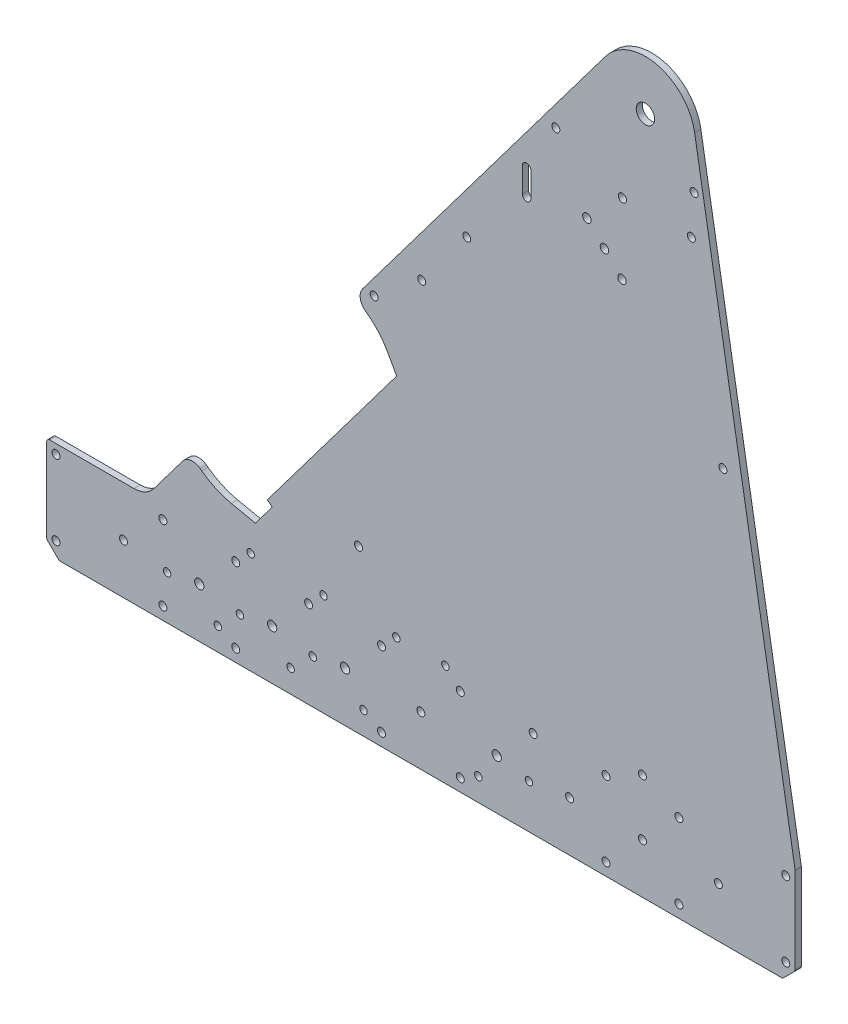
from build123d import *

# Parameters (mm, degrees)
BOSS_EXTRUDE1_DEPTH = 3.175
CUT_EXTRUDE1_REACH  = 534.132
SKETCH2_R           = 2.032
SKETCH5_R           = 2.032
SKETCH5_R_2         = 2.38125
CUT_EXTRUDE4_DEPTH  = 533.132273265
SKETCH6_R           = 2.032
CUT_EXTRUDE5_DEPTH  = 533.132273265
SKETCH3_R           = 4.699
SKETCH3_R_2         = 2.032
SKETCH3_R_3         = 2.0955
SKETCH3_R_4         = 2.159
CUT_EXTRUDE2_DEPTH  = 533.132273265
FILLET1_R           = 1.5875
CUT_EXTRUDE3_REACH  = 534.132
SKETCH4_R           = 1.905
FILLET2_R           = 38.1
FILLET3_R           = 6.35


with BuildPart() as part:
    # Sketch1 → Boss-Extrude1 (new body)
    with BuildSketch(Plane.XY):
        with BuildLine():
            Line((0, 0), (381, 0))
            Line((381, 0), (381, 50.8))
            Line((381, 50.8), (329.837432577, 350.351326687))
            ThreePointArc((329.837432577, 350.351326687), (310.787920632, 370.759100277), (284.504927721, 361.348180455))
            Line((284.504927721, 361.348180455), (157.027492501, 191.955579526))
            Line((157.027492501, 191.955579526), (169.711912675, 182.409841741))
            Line((169.711912675, 182.409841741), (178.167615548, 167.244965001))
            Line((178.167615548, 167.244965001), (112.326505112, 79.754995301))
            Line((112.326505112, 79.754995301), (114.863389147, 77.845847744))
            Line((114.863389147, 77.845847744), (106.272225141, 66.429869588))
            Line((106.272225141, 66.429869588), (85.709420174, 70.786944209))
            Line((85.709420174, 70.786944209), (73.025, 80.332681993))
            Line((73.025, 80.332681993), (54.610499914, 55.863409773))
            ThreePointArc((54.610499914, 55.863409773), (50.133294634, 52.136138511), (44.462963775, 50.8))
            Line((44.462963775, 50.8), (0, 50.8))
            Line((0, 50.8), (0, 0))
        make_face()
    extrude(amount=BOSS_EXTRUDE1_DEPTH)

    # Sketch2 → Cut-Extrude1 (cut, up to next)
    with BuildSketch(Plane.XY.offset(3.175), mode=Mode.PRIVATE) as cut_extrude1_sk1:
        with Locations((4.7625, 46.0375)):
            Circle(SKETCH2_R)
    cut_extrude1_tool1 = extrude(cut_extrude1_sk1.sketch, amount=-CUT_EXTRUDE1_REACH, mode=Mode.PRIVATE) & part.part
    # Sketch2 → Cut-Extrude1 (cut, up to next)
    with BuildSketch(Plane.XY.offset(3.175), mode=Mode.PRIVATE) as cut_extrude1_sk2:
        with Locations((4.7625, 7.9375)):
            Circle(SKETCH2_R)
    cut_extrude1_tool2 = extrude(cut_extrude1_sk2.sketch, amount=-CUT_EXTRUDE1_REACH, mode=Mode.PRIVATE) & part.part
    # Sketch2 → Cut-Extrude1 (cut, up to next)
    with BuildSketch(Plane.XY.offset(3.175), mode=Mode.PRIVATE) as cut_extrude1_sk3:
        with Locations((376.2375, 7.9375)):
            Circle(SKETCH2_R)
    cut_extrude1_tool3 = extrude(cut_extrude1_sk3.sketch, amount=-CUT_EXTRUDE1_REACH, mode=Mode.PRIVATE) & part.part
    # Sketch2 → Cut-Extrude1 (cut, up to next)
    with BuildSketch(Plane.XY.offset(3.175), mode=Mode.PRIVATE) as cut_extrude1_sk4:
        with Locations((376.2375, 46.0375)):
            Circle(SKETCH2_R)
    cut_extrude1_tool4 = extrude(cut_extrude1_sk4.sketch, amount=-CUT_EXTRUDE1_REACH, mode=Mode.PRIVATE) & part.part
    # Sketch2 → Cut-Extrude1 (cut, up to next)
    with BuildSketch(Plane.XY.offset(3.175), mode=Mode.PRIVATE) as cut_extrude1_sk5:
        Polygon((0, 6.35), (0, 0), (6.35, 0), align=None)
    cut_extrude1_tool5 = extrude(cut_extrude1_sk5.sketch, amount=-CUT_EXTRUDE1_REACH, mode=Mode.PRIVATE) & part.part
    # Sketch2 → Cut-Extrude1 (cut, up to next)
    with BuildSketch(Plane.XY.offset(3.175), mode=Mode.PRIVATE) as cut_extrude1_sk6:
        Polygon((381, 0), (374.65, 0), (381, 6.35), align=None)
    cut_extrude1_tool6 = extrude(cut_extrude1_sk6.sketch, amount=-CUT_EXTRUDE1_REACH, mode=Mode.PRIVATE) & part.part
    add(cut_extrude1_tool1.solids().sort_by_distance((4.7625, 46.0375, 3.175))[0], mode=Mode.SUBTRACT)
    add(cut_extrude1_tool2.solids().sort_by_distance((4.7625, 7.9375, 3.175))[0], mode=Mode.SUBTRACT)
    add(cut_extrude1_tool3.solids().sort_by_distance((376.2375, 7.9375, 3.175))[0], mode=Mode.SUBTRACT)
    add(cut_extrude1_tool4.solids().sort_by_distance((376.2375, 46.0375, 3.175))[0], mode=Mode.SUBTRACT)
    add(cut_extrude1_tool5.solids().sort_by_distance((2.116667, 2.116667, 3.175))[0], mode=Mode.SUBTRACT)
    add(cut_extrude1_tool6.solids().sort_by_distance((378.883333, 2.116667, 3.175))[0], mode=Mode.SUBTRACT)

    # Sketch5 → Cut-Extrude4 (cut, through all)
    with BuildSketch(Plane.XY.offset(3.175)):
        with Locations((39.116, 25.4)):
            Circle(SKETCH5_R)
        with Locations((59.182, 6.35)):
            Circle(SKETCH5_R)
        with Locations((59.182, 44.45)):
            Circle(SKETCH5_R)
        with Locations((96.266, 44.45)):
            Circle(SKETCH5_R)
        with Locations((133.35, 44.45)):
            Circle(SKETCH5_R)
        with Locations((170.434, 44.45)):
            Circle(SKETCH5_R)
        with Locations((210.566, 44.45)):
            Circle(SKETCH5_R)
        with Locations((210.566, 6.35)):
            Circle(SKETCH5_R)
        with Locations((170.434, 6.35)):
            Circle(SKETCH5_R)
        with Locations((247.65, 44.45)):
            Circle(SKETCH5_R)
        with Locations((266.192, 25.4)):
            Circle(SKETCH5_R)
        with Locations((77.724, 25.4)):
            Circle(SKETCH5_R_2)
        with Locations((114.808, 25.4)):
            Circle(SKETCH5_R_2)
        with Locations((151.892, 25.4)):
            Circle(SKETCH5_R_2)
        with Locations((229.108, 25.4)):
            Circle(SKETCH5_R_2)
        with Locations((190.5, 25.4)):
            Circle(SKETCH5_R)
        with Locations((303.276, 25.4)):
            Circle(SKETCH5_R)
        with Locations((341.884, 25.4)):
            Circle(SKETCH5_R)
    extrude(amount=-CUT_EXTRUDE4_DEPTH, mode=Mode.SUBTRACT)

    # Sketch6 → Cut-Extrude5 (cut, through all)
    with BuildSketch(Plane.XY.offset(3.175)):
        with Locations((284.734, 44.45)):
            Circle(SKETCH6_R)
        with Locations((284.734, 6.35)):
            Circle(SKETCH6_R)
        with Locations((321.818, 6.35)):
            Circle(SKETCH6_R)
        with Locations((321.818, 44.45)):
            Circle(SKETCH6_R)
        with Locations((96.266, 6.35)):
            Circle(SKETCH6_R)
        with Locations((303.276, 53.975)):
            Circle(SKETCH6_R)
    extrude(amount=-CUT_EXTRUDE5_DEPTH, mode=Mode.SUBTRACT)

    # Sketch3 → Cut-Extrude2 (cut, through all)
    with BuildSketch(Plane.XY.offset(3.175)):
        with Locations((304.8, 346.075)):
            Circle(SKETCH3_R)
        with Locations((166.6875, 196.85)):
            Circle(SKETCH3_R_2)
        with Locations((158.75, 82.55)):
            Circle(SKETCH3_R_2)
        with Locations((293.065185898, 303.201970739)):
            Circle(SKETCH3_R_3)
        with Locations((275.00852204, 285.338127639)):
            Circle(SKETCH3_R_4)
        with Locations((283.94044359, 276.30979571)):
            Circle(SKETCH3_R_4)
        with Locations((292.872365141, 267.281463781)):
            Circle(SKETCH3_R_4)
        with Locations((328.186766793, 303.440372165)):
            Circle(SKETCH3_R_2)
        with Locations((344.222991868, 209.55)):
            Circle(SKETCH3_R_2)
        with Locations((259.211844923, 317.178274551)):
            Circle(SKETCH3_R_2)
        with Locations((213.851281588, 246.342608418)):
            Circle(SKETCH3_R_2)
        with Locations((190.941510906, 215.9)):
            Circle(SKETCH3_R_2)
        with Locations((329.532322641, 323.85)):
            Circle(SKETCH3_R_2)
        with BuildLine():
            Line((242.153661094, 279.4), (242.153661094, 292.1))
            ThreePointArc((242.153661094, 292.1), (244.312661094, 294.259), (246.471661094, 292.1))
            Line((246.471661094, 292.1), (246.471661094, 279.4))
            ThreePointArc((246.471661094, 279.4), (244.312661094, 277.241), (242.153661094, 279.4))
        make_face()
    extrude(amount=-CUT_EXTRUDE2_DEPTH, mode=Mode.SUBTRACT)

    # Fillet1
    fillet1_edges = [part.edges().sort_by_distance(p)[0] for p in [
        (374.65, 0, 1.5875),
        (381, 6.35, 1.5875),
        (381, 50.8, 1.5875),
        (6.35, 0, 1.5875),
        (0, 6.35, 1.5875),
        (0, 50.8, 1.5875),
    ]]
    fillet(fillet1_edges, radius=FILLET1_R)

    # Sketch4 → Cut-Extrude3 (cut, up to next)
    with BuildSketch(Plane(origin=(0, 0, 0), x_dir=(-1, 0, 0), z_dir=(0, 0, -1)), mode=Mode.PRIVATE) as cut_extrude3_sk1:
        with Locations((-61.318145625, 22.298133105)):
            Circle(SKETCH4_R)
    cut_extrude3_tool1 = extrude(cut_extrude3_sk1.sketch, amount=-CUT_EXTRUDE3_REACH, mode=Mode.PRIVATE) & part.part
    # Sketch4 → Cut-Extrude3 (cut, up to next)
    with BuildSketch(Plane(origin=(0, 0, 0), x_dir=(-1, 0, 0), z_dir=(0, 0, -1)), mode=Mode.PRIVATE) as cut_extrude3_sk2:
        with Locations((-87.131339764, 11.605958005)):
            Circle(SKETCH4_R)
    cut_extrude3_tool2 = extrude(cut_extrude3_sk2.sketch, amount=-CUT_EXTRUDE3_REACH, mode=Mode.PRIVATE) & part.part
    # Sketch4 → Cut-Extrude3 (cut, up to next)
    with BuildSketch(Plane(origin=(0, 0, 0), x_dir=(-1, 0, 0), z_dir=(0, 0, -1)), mode=Mode.PRIVATE) as cut_extrude3_sk3:
        with Locations((-98.402145625, 22.298133105)):
            Circle(SKETCH4_R)
    cut_extrude3_tool3 = extrude(cut_extrude3_sk3.sketch, amount=-CUT_EXTRUDE3_REACH, mode=Mode.PRIVATE) & part.part
    # Sketch4 → Cut-Extrude3 (cut, up to next)
    with BuildSketch(Plane(origin=(0, 0, 0), x_dir=(-1, 0, 0), z_dir=(0, 0, -1)), mode=Mode.PRIVATE) as cut_extrude3_sk4:
        with Locations((-124.215339764, 11.605958005)):
            Circle(SKETCH4_R)
    cut_extrude3_tool4 = extrude(cut_extrude3_sk4.sketch, amount=-CUT_EXTRUDE3_REACH, mode=Mode.PRIVATE) & part.part
    # Sketch4 → Cut-Extrude3 (cut, up to next)
    with BuildSketch(Plane(origin=(0, 0, 0), x_dir=(-1, 0, 0), z_dir=(0, 0, -1)), mode=Mode.PRIVATE) as cut_extrude3_sk5:
        with Locations((-135.486145625, 22.298133105)):
            Circle(SKETCH4_R)
    cut_extrude3_tool5 = extrude(cut_extrude3_sk5.sketch, amount=-CUT_EXTRUDE3_REACH, mode=Mode.PRIVATE) & part.part
    # Sketch4 → Cut-Extrude3 (cut, up to next)
    with BuildSketch(Plane(origin=(0, 0, 0), x_dir=(-1, 0, 0), z_dir=(0, 0, -1)), mode=Mode.PRIVATE) as cut_extrude3_sk6:
        with Locations((-161.299339764, 11.605958005)):
            Circle(SKETCH4_R)
    cut_extrude3_tool6 = extrude(cut_extrude3_sk6.sketch, amount=-CUT_EXTRUDE3_REACH, mode=Mode.PRIVATE) & part.part
    # Sketch4 → Cut-Extrude3 (cut, up to next)
    with BuildSketch(Plane(origin=(0, 0, 0), x_dir=(-1, 0, 0), z_dir=(0, 0, -1)), mode=Mode.PRIVATE) as cut_extrude3_sk7:
        with Locations((-245.513854375, 22.298133105)):
            Circle(SKETCH4_R)
    cut_extrude3_tool7 = extrude(cut_extrude3_sk7.sketch, amount=-CUT_EXTRUDE3_REACH, mode=Mode.PRIVATE) & part.part
    # Sketch4 → Cut-Extrude3 (cut, up to next)
    with BuildSketch(Plane(origin=(0, 0, 0), x_dir=(-1, 0, 0), z_dir=(0, 0, -1)), mode=Mode.PRIVATE) as cut_extrude3_sk8:
        with Locations((-219.700660236, 11.605958005)):
            Circle(SKETCH4_R)
    cut_extrude3_tool8 = extrude(cut_extrude3_sk8.sketch, amount=-CUT_EXTRUDE3_REACH, mode=Mode.PRIVATE) & part.part
    # Sketch4 → Cut-Extrude3 (cut, up to next)
    with BuildSketch(Plane(origin=(0, 0, 0), x_dir=(-1, 0, 0), z_dir=(0, 0, -1)), mode=Mode.PRIVATE) as cut_extrude3_sk9:
        with Locations((-202.981986443, 51.968407021)):
            Circle(SKETCH4_R)
    cut_extrude3_tool9 = extrude(cut_extrude3_sk9.sketch, amount=-CUT_EXTRUDE3_REACH, mode=Mode.PRIVATE) & part.part
    # Sketch4 → Cut-Extrude3 (cut, up to next)
    with BuildSketch(Plane(origin=(0, 0, 0), x_dir=(-1, 0, 0), z_dir=(0, 0, -1)), mode=Mode.PRIVATE) as cut_extrude3_sk10:
        with Locations((-178.018013557, 51.968407021)):
            Circle(SKETCH4_R)
    cut_extrude3_tool10 = extrude(cut_extrude3_sk10.sketch, amount=-CUT_EXTRUDE3_REACH, mode=Mode.PRIVATE) & part.part
    # Sketch4 → Cut-Extrude3 (cut, up to next)
    with BuildSketch(Plane(origin=(0, 0, 0), x_dir=(-1, 0, 0), z_dir=(0, 0, -1)), mode=Mode.PRIVATE) as cut_extrude3_sk11:
        with Locations((-140.934013557, 51.968407021)):
            Circle(SKETCH4_R)
    cut_extrude3_tool11 = extrude(cut_extrude3_sk11.sketch, amount=-CUT_EXTRUDE3_REACH, mode=Mode.PRIVATE) & part.part
    # Sketch4 → Cut-Extrude3 (cut, up to next)
    with BuildSketch(Plane(origin=(0, 0, 0), x_dir=(-1, 0, 0), z_dir=(0, 0, -1)), mode=Mode.PRIVATE) as cut_extrude3_sk12:
        with Locations((-103.850013557, 51.968407021)):
            Circle(SKETCH4_R)
    cut_extrude3_tool12 = extrude(cut_extrude3_sk12.sketch, amount=-CUT_EXTRUDE3_REACH, mode=Mode.PRIVATE) & part.part
    add(cut_extrude3_tool1.solids().sort_by_distance((61.318146, 22.298133, 0))[0], mode=Mode.SUBTRACT)
    add(cut_extrude3_tool2.solids().sort_by_distance((87.13134, 11.605958, 0))[0], mode=Mode.SUBTRACT)
    add(cut_extrude3_tool3.solids().sort_by_distance((98.402146, 22.298133, 0))[0], mode=Mode.SUBTRACT)
    add(cut_extrude3_tool4.solids().sort_by_distance((124.21534, 11.605958, 0))[0], mode=Mode.SUBTRACT)
    add(cut_extrude3_tool5.solids().sort_by_distance((135.486146, 22.298133, 0))[0], mode=Mode.SUBTRACT)
    add(cut_extrude3_tool6.solids().sort_by_distance((161.29934, 11.605958, 0))[0], mode=Mode.SUBTRACT)
    add(cut_extrude3_tool7.solids().sort_by_distance((245.513854, 22.298133, 0))[0], mode=Mode.SUBTRACT)
    add(cut_extrude3_tool8.solids().sort_by_distance((219.70066, 11.605958, 0))[0], mode=Mode.SUBTRACT)
    add(cut_extrude3_tool9.solids().sort_by_distance((202.981986, 51.968407, 0))[0], mode=Mode.SUBTRACT)
    add(cut_extrude3_tool10.solids().sort_by_distance((178.018014, 51.968407, 0))[0], mode=Mode.SUBTRACT)
    add(cut_extrude3_tool11.solids().sort_by_distance((140.934014, 51.968407, 0))[0], mode=Mode.SUBTRACT)
    add(cut_extrude3_tool12.solids().sort_by_distance((103.850014, 51.968407, 0))[0], mode=Mode.SUBTRACT)

    # Fillet2
    fillet2_edges = [part.edges().sort_by_distance(p)[0] for p in [
        (85.709420174, 70.786944209, 1.5875),
        (169.711912675, 182.409841741, 1.5875),
    ]]
    fillet(fillet2_edges, radius=FILLET2_R)

    # Fillet3
    fillet3_edges = [part.edges().sort_by_distance(p)[0] for p in [
        (73.025, 80.332681993, 1.5875),
        (157.027492501, 191.955579526, 1.5875),
    ]]
    fillet(fillet3_edges, radius=FILLET3_R)


solid = part.part
